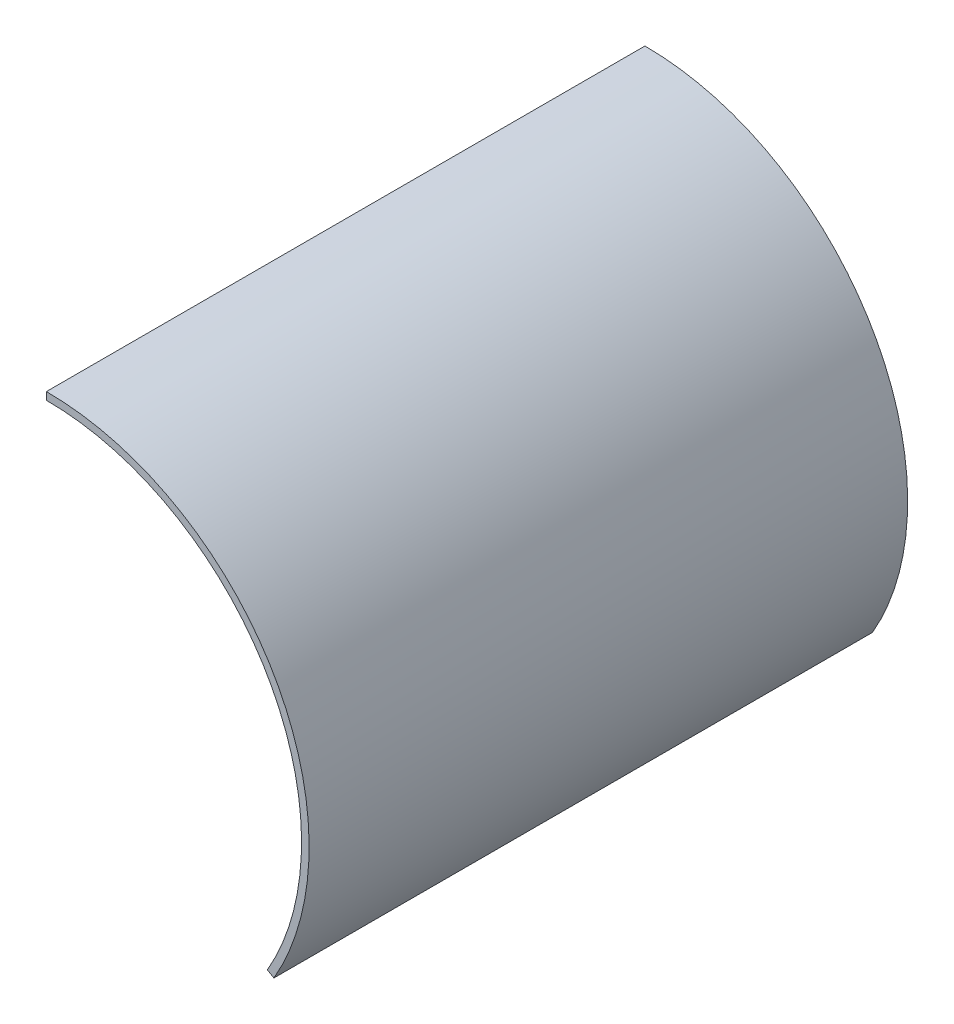
from build123d import *

# Parameters (mm, degrees)
SKETCH_1_W      = 95
SKETCH_1_H      = 1.2
REVOLVE_1_ANGLE = 120


with BuildPart() as part:
    # Эскиз1 → Повернуть1 (revolve)
    with BuildSketch(Plane(origin=(0, 0, 0), x_dir=(0, 0, -1), z_dir=(1, 0, 0))):
        with Locations((47.5, 41.1)):
            Rectangle(SKETCH_1_W, SKETCH_1_H)
    revolve(axis=Axis((0, 0, 0), (0, 0, -1)), revolution_arc=REVOLVE_1_ANGLE)


solid = part.part
